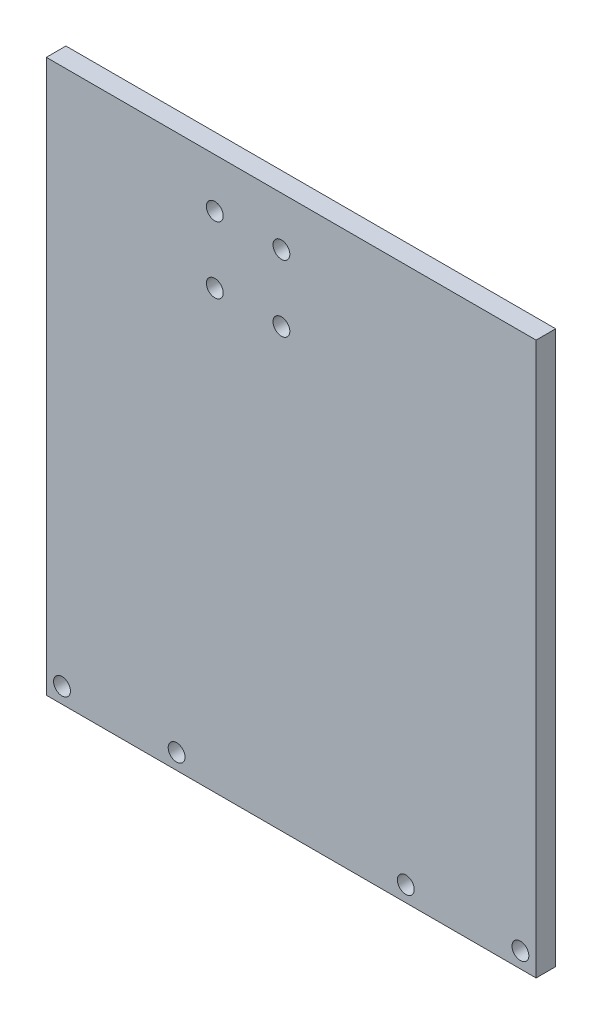
from build123d import *

# Parameters (mm, degrees)
SKETCH1_W           = 125
SKETCH1_H           = 141
SKETCH1_R           = 2.15
BOSS_EXTRUDE1_DEPTH = 2.5


with BuildPart() as part:
    # Sketch1 → Boss-Extrude1 (new, symmetric)
    with BuildSketch(Plane.XY):
        Rectangle(SKETCH1_W, SKETCH1_H)
        with Locations((-19.5, 58)):
            Circle(SKETCH1_R, mode=Mode.SUBTRACT)
        with Locations((-2.5, 58)):
            Circle(SKETCH1_R, mode=Mode.SUBTRACT)
        with Locations((-2.5, 41)):
            Circle(SKETCH1_R, mode=Mode.SUBTRACT)
        with Locations((-19.5, 41)):
            Circle(SKETCH1_R, mode=Mode.SUBTRACT)
        with Locations((-58.5, -66.5)):
            Circle(SKETCH1_R, mode=Mode.SUBTRACT)
        with Locations((58.5, -66.5)):
            Circle(SKETCH1_R, mode=Mode.SUBTRACT)
        with Locations((-29.25, -66.5)):
            Circle(SKETCH1_R, mode=Mode.SUBTRACT)
        with Locations((29.25, -66.5)):
            Circle(SKETCH1_R, mode=Mode.SUBTRACT)
    extrude(amount=BOSS_EXTRUDE1_DEPTH, both=True)


solid = part.part
